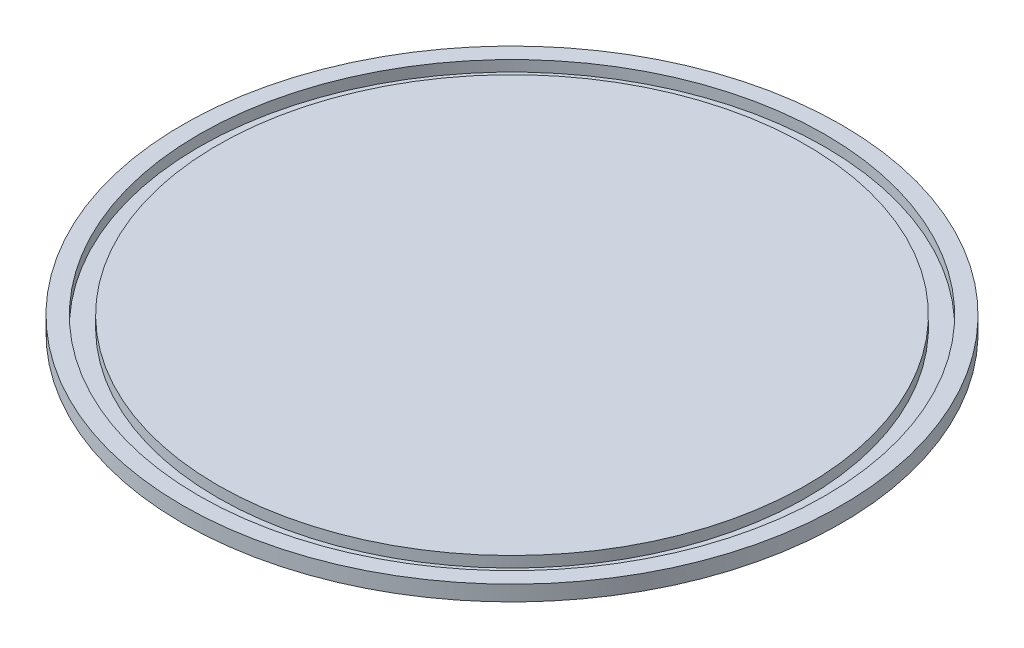
from build123d import *

# Parameters (mm, degrees)
SKETCH_6_R      = 72.75
SKETCH_6_R_2    = 69.1
EXTRUDE_4_DEPTH = 2.4
SKETCH_6_3_R    = 65
EXTRUDE_5_DEPTH = 2.4
EXTRUDE_START   = -1
SKETCH_6_4_R    = 72.75
EXTRUDE_6_DEPTH = 1


with BuildPart() as part:
    # 草圖6 → 填料-伸長4 (new body)
    with BuildSketch(Plane(origin=(0, 0, 0), x_dir=(1, 0, 0), z_dir=(0, 1, 0))):
        Circle(SKETCH_6_R)
        Circle(SKETCH_6_R_2, mode=Mode.SUBTRACT)
    extrude(amount=EXTRUDE_4_DEPTH)



with BuildPart() as body_2:
    # 草圖6<3> → 填料-伸長5 (new body)
    with BuildSketch(Plane(origin=(0, 0, 0), x_dir=(1, 0, 0), z_dir=(0, 1, 0))):
        Circle(SKETCH_6_3_R)
    extrude(amount=EXTRUDE_5_DEPTH)


with BuildPart() as part_1:
    add(part.part)

    add(body_2.part)  # 填料-伸長6 merges body 2
    # 草圖6<4> → 填料-伸長6 (add)
    with BuildSketch(Plane(origin=(0, 0, 0), x_dir=(1, 0, 0), z_dir=(0, 1, 0)).offset(EXTRUDE_START)):
        Circle(SKETCH_6_4_R)
    extrude(amount=EXTRUDE_6_DEPTH)


solid = part_1.part
